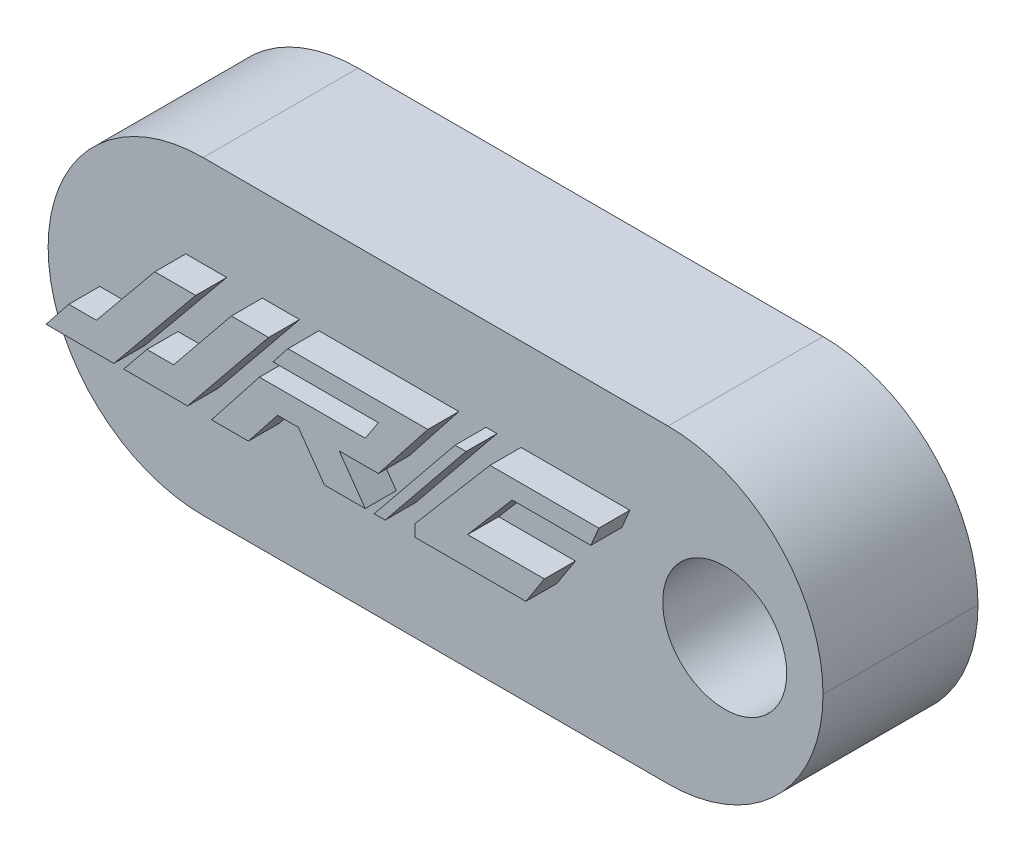
from build123d import *

# Parameters (mm, degrees)
ESQUISSE1_W             = 50
ESQUISSE1_H             = 20
BOSS_EXTRU_1_DEPTH      = 10
CONG_1_R                = 10
ESQUISSE2_R             = 4
ENL_V_MAT_EXTRU_1_DEPTH = 29.722813233
BOSS_EXTRU_2_DEPTH      = 2


with BuildPart() as part:
    # Esquisse1 → Boss.-Extru.1 (new body)
    with BuildSketch(Plane.XY):
        Rectangle(ESQUISSE1_W, ESQUISSE1_H)
    extrude(amount=BOSS_EXTRU_1_DEPTH)

    # Congé1
    cong_1_edges = [part.edges().sort_by_distance(p)[0] for p in [
        (-25, 10, 5),
        (25, 10, 5),
        (25, -10, 5),
        (-25, -10, 5),
    ]]
    fillet(cong_1_edges, radius=CONG_1_R - 0.0001)  # a hair under: the kernel refuses the full size

    # Esquisse2 → Enlèv. mat.-Extru.1 (cut, through all)
    with BuildSketch(Plane.XY.offset(10)):
        with Locations((18.655435278, 0)):
            Circle(ESQUISSE2_R)
    extrude(amount=-ENL_V_MAT_EXTRU_1_DEPTH, mode=Mode.SUBTRACT)

    # Esquisse3 → Boss.-Extru.2 (add)
    with BuildSketch(Plane.XY.offset(10)):
        Polygon((-23.137412504, -2.382112664), (-18.75901173, -2.382112664), (-13.477180662, 4.059144735), (-16.118096196, 4.059144735), (-19.884214818, -0.533682853), (-21.669171822, -0.533682853), align=None)
        Polygon((-18.126480253, -2.382112664), (-14.004075518, -2.382112664), (-8.774539808, 4.059144735), (-11.177021234, 4.059144735), (-14.905851553, -0.533682853), (-16.625774862, -0.533682853), align=None)
        Polygon((-12.458173742, -2.382112664), (-10.074908504, -2.382112664), (-8.200459195, 0), (-6.854279805, 0), (-5.173191017, -2.382112664), (-2.538637347, -2.382112664), (-4.219726135, 0), (-1.691447938, 0), (1.502633165, 4.059144735), (-7.5273695, 4.059144735), (-8.487196781, 2.839364232), (-1.691447938, 2.839364232), (-2.538637347, 1.547054349), (-9.36637019, 1.547054349), align=None)
        Polygon((3.258494312, 4.059144735), (3.967032626, 4.059144735), (-1.250385868, -2.382112664), (-1.958924181, -2.382112664), align=None)
        Polygon((7.831787065, -2.382112664), (0.681991352, -2.382112664), (0.681991352, -1.609161776), (5.512934401, 4.059144735), (12.533904966, 4.059144735), (12.018604374, 2.839364232), (6.944143524, 2.839364232), (4.069387486, -0.533682853), (9.023419684, -0.533682853), align=None)
    extrude(amount=BOSS_EXTRU_2_DEPTH)


solid = part.part
